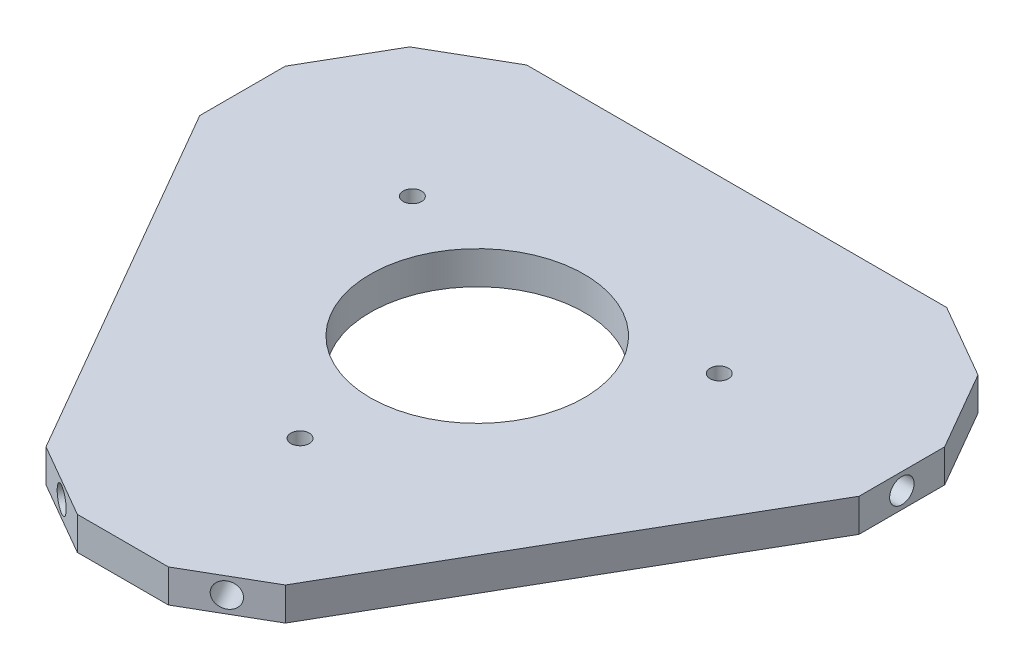
from build123d import *

# Parameters (mm, degrees)
BOSS_EXTRUDE2_DEPTH       = 5.4
F_3_0MM_DOWEL_HOLE1_D     = 4
F_3_0MM_DOWEL_HOLE1_DEPTH = 10
F_3_0MM_DOWEL_HOLE1_TIP   = 1.201721238
F_3_0MM_DOWEL_HOLE2_D     = 4
F_3_0MM_DOWEL_HOLE2_DEPTH = 10
F_3_0MM_DOWEL_HOLE2_TIP   = 1.201721238
F_3_0MM_DOWEL_HOLE3_D     = 4
F_3_0MM_DOWEL_HOLE3_DEPTH = 10
F_3_0MM_DOWEL_HOLE3_TIP   = 1.201721238
F_3_0MM_DOWEL_HOLE4_D     = 4
F_3_0MM_DOWEL_HOLE4_DEPTH = 10
F_3_0MM_DOWEL_HOLE4_TIP   = 1.201721238
F_3_0MM_DOWEL_HOLE5_D     = 4
F_3_0MM_DOWEL_HOLE5_DEPTH = 10
F_3_0MM_DOWEL_HOLE5_TIP   = 1.201721238
F_3_0MM_DOWEL_HOLE6_D     = 4
F_3_0MM_DOWEL_HOLE6_DEPTH = 10
F_3_0MM_DOWEL_HOLE6_TIP   = 1.201721238
SKETCH23_R                = 17.5
CUT_EXTRUDE1_DEPTH        = 211.795738776
CUT_EXTRUDE2_DEPTH        = 211.795738776
CUT_EXTRUDE2_DEPTH_BACK   = 211.795738776
SKETCH24_R                = 1.5


with BuildPart() as part:
    # Sketch1 → Boss-Extrude2 (new body)
    with BuildSketch(Plane(origin=(0, 0, 0), x_dir=(1, 0, 0), z_dir=(0, 1, 0))):
        Polygon((-181.608413742, -39.986262339), (-139.182006871, -113.470954622), (-108.123721459, -113.470954622), (-65.697314588, -39.986262339), (-81.226457294, -13.088998174), (-166.079271036, -13.088998174), align=None)
    extrude(amount=BOSS_EXTRUDE2_DEPTH)

    # Chamfer3
    # the kernel refuses this chamfer: 14 mm, written as the material it takes off along each edge
    with BuildSketch(Plane(origin=(-139.182006871, -21.431130006, 113.470954622), x_dir=(-0.5280200004833012, 0, -0.8492319348032166), z_dir=(0, 1, 0))) as chamfer3_piece_1:
        with BuildLine():
            Line((8.572452002, 0), (-4.761795885, -7.128270007))
            Line((-4.761795885, -7.128270007), (-4.999580826, -6.980424406))
            ThreePointArc((-4.999580826, -6.980424406), (-2.499790413, -3.490212203), (-0.237784942, 0.1478456))
            Line((-0.237784942, 0.1478456), (0.009145575, 0.2798506))
            ThreePointArc((0.009145575, 0.2798506), (4.290798789, 0.1399253), (8.581597577, 0.2798506))
            Line((8.581597577, 0.2798506), (8.572452002, 0))
        make_face()
    extrude(amount=48.262260012, mode=Mode.SUBTRACT)

    # Chamfer4
    # the kernel refuses this chamfer: 14 mm, written as the material it takes off along each edge
    with BuildSketch(Plane(origin=(-108.123721459, -21.431130006, 113.470954622), x_dir=(0.5280200004833001, 0, -0.8492319348032171), z_dir=(0, 1, 0))) as chamfer4_piece_1:
        with BuildLine():
            Line((8.572452002, 0), (-4.761795885, 7.128270007))
            Line((-4.761795885, 7.128270007), (-4.999580826, 6.980424406))
            ThreePointArc((-4.999580826, 6.980424406), (-2.499790413, 3.490212203), (-0.237784942, -0.1478456))
            Line((-0.237784942, -0.1478456), (0.009145575, -0.2798506))
            ThreePointArc((0.009145575, -0.2798506), (4.290798789, -0.1399253), (8.581597577, -0.2798506))
            Line((8.581597577, -0.2798506), (8.572452002, 0))
        make_face()
    extrude(amount=48.262260012, mode=Mode.SUBTRACT)

    # Chamfer5
    # the kernel refuses this chamfer: 14 mm, written as the material it takes off along each edge
    with BuildSketch(Plane(origin=(-65.697314588, -21.431130006, 39.986262339), x_dir=(-0.47144642900294653, 0, -0.8818947015264179), z_dir=(0, 1, 0))) as chamfer5_piece_1:
        with BuildLine():
            Line((8.572452002, 0), (-4.761795885, 7.128270007))
            Line((-4.761795885, 7.128270007), (-4.999580826, 6.980424406))
            ThreePointArc((-4.999580826, 6.980424406), (-2.499790413, 3.490212203), (-0.237784942, -0.1478456))
            Line((-0.237784942, -0.1478456), (0.009145575, -0.2798506))
            ThreePointArc((0.009145575, -0.2798506), (4.290798789, -0.1399253), (8.581597577, -0.2798506))
            Line((8.581597577, -0.2798506), (8.572452002, 0))
        make_face()
    extrude(amount=48.262260012, mode=Mode.SUBTRACT)

    # Chamfer6
    # the kernel refuses this chamfer: 14 mm, written as the material it takes off along each edge
    with BuildSketch(Plane(origin=(-81.226457294, -21.431130006, 13.088998174), x_dir=(0.5280200004833007, 0, 0.8492319348032168), z_dir=(0, 1, 0))) as chamfer6_piece_1:
        with BuildLine():
            Line((8.572452002, 0), (-4.761795885, -7.128270007))
            Line((-4.761795885, -7.128270007), (-4.999580826, -6.980424406))
            ThreePointArc((-4.999580826, -6.980424406), (-2.499790413, -3.490212203), (-0.237784942, 0.1478456))
            Line((-0.237784942, 0.1478456), (0.009145575, 0.2798506))
            ThreePointArc((0.009145575, 0.2798506), (4.290798789, 0.1399253), (8.581597577, 0.2798506))
            Line((8.581597577, 0.2798506), (8.572452002, 0))
        make_face()
    extrude(amount=48.262260012, mode=Mode.SUBTRACT)

    # Chamfer7
    # the kernel refuses this chamfer: 14 mm, written as the material it takes off along each edge
    with BuildSketch(Plane(origin=(-166.079271036, -21.431130006, 13.088998174), x_dir=(-0.5280200004833, 0, 0.8492319348032173), z_dir=(0, 1, 0))) as chamfer7_piece_1:
        with BuildLine():
            Line((8.572452002, 0), (-4.761795885, 7.128270007))
            Line((-4.761795885, 7.128270007), (-4.999580826, 6.980424406))
            ThreePointArc((-4.999580826, 6.980424406), (-2.499790413, 3.490212203), (-0.237784942, -0.1478456))
            Line((-0.237784942, -0.1478456), (0.009145575, -0.2798506))
            ThreePointArc((0.009145575, -0.2798506), (4.290798789, -0.1399253), (8.581597577, -0.2798506))
            Line((8.581597577, -0.2798506), (8.572452002, 0))
        make_face()
    extrude(amount=48.262260012, mode=Mode.SUBTRACT)

    # Chamfer8
    # the kernel refuses this chamfer: 14 mm, written as the material it takes off along each edge
    with BuildSketch(Plane(origin=(-181.608413742, -21.431130006, 39.986262339), x_dir=(0.4714464290029468, 0, 0.8818947015264177), z_dir=(0, 1, 0))) as chamfer8_piece_1:
        with BuildLine():
            Line((8.572452002, 0), (-4.761795885, 7.128270007))
            Line((-4.761795885, 7.128270007), (-4.999580826, 6.980424406))
            ThreePointArc((-4.999580826, 6.980424406), (-2.499790413, 3.490212203), (-0.237784942, -0.1478456))
            Line((-0.237784942, -0.1478456), (0.009145575, -0.2798506))
            ThreePointArc((0.009145575, -0.2798506), (4.290798789, -0.1399253), (8.581597577, -0.2798506))
            Line((8.581597577, -0.2798506), (8.572452002, 0))
        make_face()
    extrude(amount=48.262260012, mode=Mode.SUBTRACT)

    # Ø3.0mm Dowel Hole1
    with Locations(Plane(origin=(-81.909140423, 0, 141.870792817), x_dir=(0.8660254037844395, 0, 0.49999999999999856), z_dir=(-0.49999999999999856, 0, 0.8660254037844395))):
        with Locations((-63.799676389, 2.7)):
            Hole(F_3_0MM_DOWEL_HOLE1_D / 2, depth=F_3_0MM_DOWEL_HOLE1_DEPTH)
            with Locations((0, 0, -(F_3_0MM_DOWEL_HOLE1_DEPTH + F_3_0MM_DOWEL_HOLE1_TIP / 2))):  # 118° drill point
                Cone(0, F_3_0MM_DOWEL_HOLE1_D / 2, F_3_0MM_DOWEL_HOLE1_TIP, mode=Mode.SUBTRACT)

    # Ø3.0mm Dowel Hole2
    with Locations(Plane(origin=(20.08270834, 0, 34.784271199), x_dir=(0.8660254037844377, 0, -0.5000000000000018), z_dir=(0.5000000000000018, 0, 0.8660254037844377))):
        with Locations((-150.373366846, 2.7)):
            Hole(F_3_0MM_DOWEL_HOLE2_D / 2, depth=F_3_0MM_DOWEL_HOLE2_DEPTH)
            with Locations((0, 0, -(F_3_0MM_DOWEL_HOLE2_DEPTH + F_3_0MM_DOWEL_HOLE2_TIP / 2))):  # 118° drill point
                Cone(0, F_3_0MM_DOWEL_HOLE2_D / 2, F_3_0MM_DOWEL_HOLE2_TIP, mode=Mode.SUBTRACT)

    # Ø3.0mm Dowel Hole3
    with Locations(Plane(origin=(-69.738766472, 0, 0), x_dir=(0, 0, -1), z_dir=(1, 0, 0))):
        with Locations((-39.986262339, 2.7)):
            Hole(F_3_0MM_DOWEL_HOLE3_D / 2, depth=F_3_0MM_DOWEL_HOLE3_DEPTH)
            with Locations((0, 0, -(F_3_0MM_DOWEL_HOLE3_DEPTH + F_3_0MM_DOWEL_HOLE3_TIP / 2))):  # 118° drill point
                Cone(0, F_3_0MM_DOWEL_HOLE3_D / 2, F_3_0MM_DOWEL_HOLE3_TIP, mode=Mode.SUBTRACT)

    # Ø3.0mm Dowel Hole4
    with Locations(Plane(origin=(-27.99504273, 0, 48.488836368), x_dir=(-0.8660254037844382, 0, -0.5000000000000009), z_dir=(0.5000000000000009, 0, -0.8660254037844382))):
        with Locations((63.799676389, 2.7)):
            Hole(F_3_0MM_DOWEL_HOLE4_D / 2, depth=F_3_0MM_DOWEL_HOLE4_DEPTH)
            with Locations((0, 0, -(F_3_0MM_DOWEL_HOLE4_DEPTH + F_3_0MM_DOWEL_HOLE4_TIP / 2))):  # 118° drill point
                Cone(0, F_3_0MM_DOWEL_HOLE4_D / 2, F_3_0MM_DOWEL_HOLE4_TIP, mode=Mode.SUBTRACT)

    # Ø3.0mm Dowel Hole5
    with Locations(Plane(origin=(-33.831389353, 0, -58.597685249), x_dir=(-0.8660254037844384, 0, 0.5000000000000004), z_dir=(-0.5000000000000004, 0, -0.8660254037844384))):
        with Locations((150.373366846, 2.7)):
            Hole(F_3_0MM_DOWEL_HOLE5_D / 2, depth=F_3_0MM_DOWEL_HOLE5_DEPTH)
            with Locations((0, 0, -(F_3_0MM_DOWEL_HOLE5_DEPTH + F_3_0MM_DOWEL_HOLE5_TIP / 2))):  # 118° drill point
                Cone(0, F_3_0MM_DOWEL_HOLE5_D / 2, F_3_0MM_DOWEL_HOLE5_TIP, mode=Mode.SUBTRACT)

    # Ø3.0mm Dowel Hole6
    with Locations(Plane.ZY.offset(177.566961858)):
        with Locations((39.986262339, 2.7)):
            Hole(F_3_0MM_DOWEL_HOLE6_D / 2, depth=F_3_0MM_DOWEL_HOLE6_DEPTH)
            with Locations((0, 0, -(F_3_0MM_DOWEL_HOLE6_DEPTH + F_3_0MM_DOWEL_HOLE6_TIP / 2))):  # 118° drill point
                Cone(0, F_3_0MM_DOWEL_HOLE6_D / 2, F_3_0MM_DOWEL_HOLE6_TIP, mode=Mode.SUBTRACT)

    # Sketch23 → Cut-Extrude1 (cut, through all)
    with BuildSketch(Plane(origin=(0, 5.4, 0), x_dir=(1, 0, 0), z_dir=(0, 1, 0))):
        with Locations(Location((-123.652864165, -55.515405045, 0), (0, 0, 270))):
            Circle(SKETCH23_R)
    extrude(amount=-CUT_EXTRUDE1_DEPTH, mode=Mode.SUBTRACT)

    # Sketch24 → Cut-Extrude2 (cut, two sides: drawn at the far end of the back side and taken through both)
    with BuildSketch(Plane(origin=(0, 5.4, 0), x_dir=(1, 0, 0), z_dir=(0, 1, 0)).offset(-CUT_EXTRUDE2_DEPTH_BACK)):
        with Locations(Location((-98.557375053, -41.02651765, 0), (0, 0, 270))):
            Circle(SKETCH24_R)
        with Locations(Location((-148.748353277, -41.02651765, 0), (0, 0, 270))):
            Circle(SKETCH24_R)
        with Locations(Location((-123.652864165, -84.493179833, 0), (0, 0, 270))):
            Circle(SKETCH24_R)
    extrude(amount=CUT_EXTRUDE2_DEPTH + CUT_EXTRUDE2_DEPTH_BACK, mode=Mode.SUBTRACT)


solid = part.part
